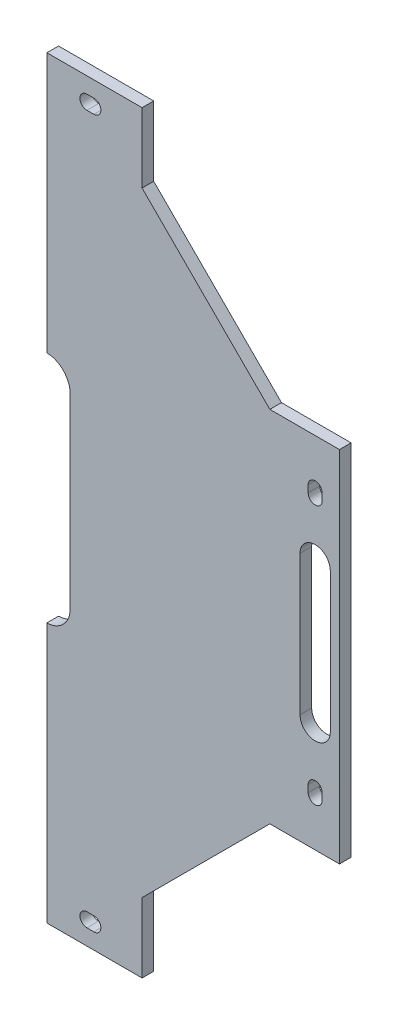
from build123d import *

# Parameters (mm, degrees)
BOSS_EXTRUDE1_DEPTH = 5
CUT_EXTRUDE5_DEPTH  = 5
CUT_EXTRUDE7_START  = -10
CUT_EXTRUDE7_DEPTH  = 10


with BuildPart() as part:
    # Sketch1 → Boss-Extrude1 (new body)
    with BuildSketch(Plane.XY):
        with BuildLine():
            Line((274.548117157, -297.565438631), (233.296854498, -297.565438631))
            Line((233.296854498, -297.565438631), (233.296854498, -409.565438631))
            ThreePointArc((233.296854498, -409.565438631), (240.36792231, -412.494370819), (243.296854498, -419.565438631))
            Line((243.296854498, -419.565438631), (243.296854498, -499.565438631))
            ThreePointArc((243.296854498, -499.565438631), (240.36792231, -506.636506443), (233.296854498, -509.565438631))
            Line((233.296854498, -509.565438631), (233.296854498, -621.565438631))
            Line((233.296854498, -621.565438631), (274.568117157, -621.565438631))
            Line((274.568117157, -621.565438631), (274.548117157, -591.565438631))
            Line((274.548117157, -591.565438631), (329.296854498, -536.81670129))
            Line((329.296854498, -536.81670129), (359.296854498, -536.81670129))
            Line((359.296854498, -536.81670129), (359.296854498, -382.314175973))
            Line((359.296854498, -382.314175973), (329.296854498, -382.314175973))
            Line((329.296854498, -382.314175973), (274.548117157, -327.565438631))
            Line((274.548117157, -327.565438631), (274.548117157, -297.565438631))
        make_face()
    extrude(amount=BOSS_EXTRUDE1_DEPTH)

    # Sketch4 → Cut-Extrude5 (cut)
    with BuildSketch(Plane.XY):
        with BuildLine():
            Line((250.668694694, -608.565438631), (253.668694694, -608.565438631))
            ThreePointArc((253.668694694, -608.565438631), (256.668694694, -611.565438631), (253.668694694, -614.565438631))
            Line((253.668694694, -614.565438631), (250.668694694, -614.565438631))
            ThreePointArc((250.668694694, -614.565438631), (247.668694694, -611.565438631), (250.668694694, -608.565438631))
        make_face()
        with BuildLine():
            Line((250.668694694, -310.565438631), (253.668694694, -310.565438631))
            ThreePointArc((253.668694694, -310.565438631), (256.668694694, -307.565438631), (253.668694694, -304.565438631))
            Line((253.668694694, -304.565438631), (250.668694694, -304.565438631))
            ThreePointArc((250.668694694, -304.565438631), (247.668694694, -307.565438631), (250.668694694, -310.565438631))
        make_face()
        with BuildLine():
            Line((351.670669768, -402.325054724), (351.670669768, -405.325054724))
            ThreePointArc((351.670669768, -405.325054724), (348.670669768, -408.325054724), (345.670669768, -405.325054724))
            Line((345.670669768, -405.325054724), (345.670669768, -402.325054724))
            ThreePointArc((345.670669768, -402.325054724), (348.670669768, -399.325054724), (351.670669768, -402.325054724))
        make_face()
        with BuildLine():
            Line((351.670669768, -516.805822539), (351.670669768, -513.805822539))
            ThreePointArc((351.670669768, -513.805822539), (348.670669768, -510.805822539), (345.670669768, -513.805822539))
            Line((345.670669768, -513.805822539), (345.670669768, -516.805822539))
            ThreePointArc((345.670669768, -516.805822539), (348.670669768, -519.805822539), (351.670669768, -516.805822539))
        make_face()
        with BuildLine():
            Line((355.170669768, -429.565438631), (355.170669768, -489.565438631))
            ThreePointArc((355.170669768, -489.565438631), (348.670669768, -496.065438631), (342.170669768, -489.565438631))
            Line((342.170669768, -489.565438631), (342.170669768, -429.565438631))
            ThreePointArc((342.170669768, -429.565438631), (348.670669768, -423.065438631), (355.170669768, -429.565438631))
        make_face()
    extrude(amount=CUT_EXTRUDE5_DEPTH, mode=Mode.SUBTRACT)

    # Sketch12 → Cut-Extrude7 (cut)
    with BuildSketch(Plane.XY.offset(5).offset(CUT_EXTRUDE7_START)):
        with BuildLine():
            Line((243.296854498, -419.565438631), (243.296854498, -499.565438631))
            ThreePointArc((243.296854498, -499.565438631), (240.36792231, -506.636506443), (233.296854498, -509.565438631))
            Line((233.296854498, -509.565438631), (233.296854498, -621.565438631))
            Line((233.296854498, -621.565438631), (274.568117157, -621.565438631))
            Line((274.568117157, -621.565438631), (274.548117157, -591.565438631))
            Line((274.548117157, -591.565438631), (329.296854498, -536.81670129))
            Line((329.296854498, -536.81670129), (359.296854498, -536.81670129))
            Line((359.296854498, -536.81670129), (359.296854498, -382.314175973))
            Line((359.296854498, -382.314175973), (329.296854498, -382.314175973))
            Line((329.296854498, -382.314175973), (274.548117157, -327.565438631))
            Line((274.548117157, -327.565438631), (274.548117157, -297.565438631))
            Line((274.548117157, -297.565438631), (233.296854498, -297.565438631))
            Line((233.296854498, -297.565438631), (233.296854498, -409.565438631))
            ThreePointArc((233.296854498, -409.565438631), (240.36792231, -412.494370819), (243.296854498, -419.565438631))
        make_face()
        with BuildLine():
            Line((243.496854498, -419.565438631), (243.496854498, -499.565438631))
            ThreePointArc((243.496854498, -499.565438631), (240.579711081, -506.70686706), (233.496854498, -509.763477658))
            Line((233.496854498, -509.763477658), (233.496854498, -621.365438631))
            Line((233.496854498, -621.365438631), (274.367983779, -621.365438631))
            Line((274.367983779, -621.365438631), (274.348061921, -591.482651155))
            Line((274.348061921, -591.482651155), (329.214011786, -536.61670129))
            Line((329.214011786, -536.61670129), (359.096854498, -536.61670129))
            Line((359.096854498, -536.61670129), (359.096854498, -382.514175973))
            Line((359.096854498, -382.514175973), (329.214011786, -382.514175973))
            Line((329.214011786, -382.514175973), (274.348117157, -327.648281344))
            Line((274.348117157, -327.648281344), (274.348117157, -297.765438631))
            Line((274.348117157, -297.765438631), (233.496854498, -297.765438631))
            Line((233.496854498, -297.765438631), (233.496854498, -409.367399604))
            ThreePointArc((233.496854498, -409.367399604), (240.579711081, -412.424010203), (243.496854498, -419.565438631))
        make_face(mode=Mode.SUBTRACT)
    extrude(amount=CUT_EXTRUDE7_DEPTH, mode=Mode.SUBTRACT)


solid = part.part
